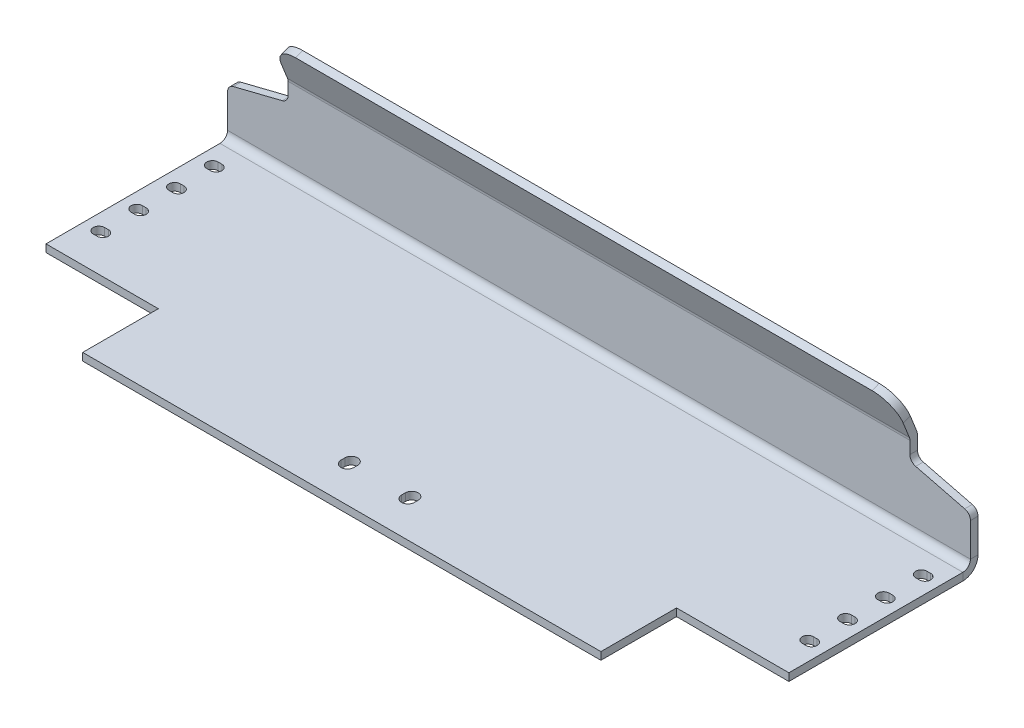
from build123d import *

# Parameters (mm, degrees)
SM_BASE_FLANGE_1_DEPTH = 491
CUT_EXTRUDE_1_REACH    = 576.223
CUT_EXTRUDE_2_DEPTH    = 575.223290751
PATTERN_LINEAR_1_COUNT = 4
PATTERN_LINEAR_1_PITCH = 50
FILLET_1_R             = 30
SKETCH_4_W             = 685
SKETCH_4_H             = 100
EXTRUDE_1_DEPTH        = 10
CUT_EXTRUDE_3_DEPTH    = 10
FILLET_2_R             = 10


# Sheet-metal steps are written as plain solids
with BuildPart() as part:
    # Sketch 1 → 基体-法兰1 (new, symmetric)
    with BuildSketch(Plane(origin=(0, 0, 0), x_dir=(0, 0, -1), z_dir=(1, 0, 0))):
        with BuildLine():
            Line((0, 0), (230, 0))
            ThreePointArc((230, 0), (237.071067812, 2.928932188), (240, 10))
            Line((240, 10), (240, 106.074175964))
            ThreePointArc((240, 106.074175964), (239.819563867, 107.965251176), (239.284766909, 109.788082728))
            Line((239.284766909, 109.788082728), (220, 158))
            Line((220, 158), (229.284766909, 161.713906764))
            Line((229.284766909, 161.713906764), (248.569533818, 113.501989491))
            ThreePointArc((248.569533818, 113.501989491), (249.639127735, 109.856326387), (250, 106.074175964))
            Line((250, 106.074175964), (250, 10))
            ThreePointArc((250, 10), (244.142135624, -4.142135624), (230, -10))
            Line((230, -10), (0, -10))
            Line((0, -10), (0, 0))
        make_face()
    extrude(amount=SM_BASE_FLANGE_1_DEPTH, both=True)

    # Sketch 2 → 切除-拉伸1 (cut, up to next)
    with BuildSketch(Plane(origin=(0, 0, -250), x_dir=(-1, 0, 0), z_dir=(0, 0, -1)), mode=Mode.PRIVATE) as cut_extrude_1_sk1:
        Polygon((-411, 161.713906764), (-411, 82), (-491, 62), (-491, 161.713906764), align=None)
    cut_extrude_1_tool1 = extrude(cut_extrude_1_sk1.sketch, amount=-CUT_EXTRUDE_1_REACH, mode=Mode.PRIVATE) & part.part
    # Sketch 2 → 切除-拉伸1 (cut, up to next)
    with BuildSketch(Plane(origin=(0, 0, -250), x_dir=(-1, 0, 0), z_dir=(0, 0, -1)), mode=Mode.PRIVATE) as cut_extrude_1_sk2:
        Polygon((491, 161.713906764), (411, 161.713906764), (411, 82), (491, 62), align=None)
    cut_extrude_1_tool2 = extrude(cut_extrude_1_sk2.sketch, amount=-CUT_EXTRUDE_1_REACH, mode=Mode.PRIVATE) & part.part
    add(cut_extrude_1_tool1.solids().sort_by_distance((452.486206, 116.671178, -250))[0], mode=Mode.SUBTRACT)
    add(cut_extrude_1_tool2.solids().sort_by_distance((-452.486206, 116.671178, -250))[0], mode=Mode.SUBTRACT)

    # 草图3 → 切除-拉伸2 (cut, through all)
    with BuildSketch(Plane(origin=(0, 0, 0), x_dir=(1, 0, 0), z_dir=(0, 1, 0))):
        with BuildLine():
            Line((466, 57.5), (471, 57.5))
            ThreePointArc((471, 57.5), (478.5, 50), (471, 42.5))
            Line((471, 42.5), (466, 42.5))
            ThreePointArc((466, 42.5), (458.5, 50), (466, 57.5))
        make_face()
        with BuildLine():
            Line((-466, 42.5), (-471, 42.5))
            ThreePointArc((-471, 42.5), (-478.5, 50), (-471, 57.5))
            Line((-471, 57.5), (-466, 57.5))
            ThreePointArc((-466, 57.5), (-458.5, 50), (-466, 42.5))
        make_face()
    cut_extrude_2 = extrude(amount=-CUT_EXTRUDE_2_DEPTH, mode=Mode.SUBTRACT)

    # 阵列(线性)1: 切除-拉伸2 ×4
    with Locations(*[(0, 0, -i * PATTERN_LINEAR_1_PITCH) for i in range(1, PATTERN_LINEAR_1_COUNT)]):
        add(cut_extrude_2, mode=Mode.SUBTRACT)

    # 圆角1
    fillet_1_edges = [part.edges().sort_by_distance(p)[0] for p in [
        (411, 159.856953382, -224.642383454),
        (-411, 159.856953382, -224.642383454),
    ]]
    fillet(fillet_1_edges, radius=FILLET_1_R)

    # 草图4 → 凸台-拉伸1 (add)
    with BuildSketch(Plane(origin=(0, 0, 0), x_dir=(1, 0, 0), z_dir=(0, 1, 0))):
        with Locations((0, -50)):
            Rectangle(SKETCH_4_W, SKETCH_4_H)
    extrude(amount=-EXTRUDE_1_DEPTH)

    # 草图5 → 切除-拉伸3 (cut)
    with BuildSketch(Plane(origin=(0, 0, 0), x_dir=(1, 0, 0), z_dir=(0, 1, 0))):
        with BuildLine():
            Line((-31.5, -47.5), (-31.5, -52.5))
            ThreePointArc((-31.5, -52.5), (-40, -61), (-48.5, -52.5))
            Line((-48.5, -52.5), (-48.5, -47.5))
            ThreePointArc((-48.5, -47.5), (-40, -39), (-31.5, -47.5))
        make_face()
        with BuildLine():
            Line((48.5, -47.5), (48.5, -52.5))
            ThreePointArc((48.5, -52.5), (40, -61), (31.5, -52.5))
            Line((31.5, -52.5), (31.5, -47.5))
            ThreePointArc((31.5, -47.5), (40, -39), (48.5, -47.5))
        make_face()
    extrude(amount=-CUT_EXTRUDE_3_DEPTH, mode=Mode.SUBTRACT)

    # 圆角2
    fillet_2_edges = [part.edges().sort_by_distance(p)[0] for p in [
        (491, 62, -245),
        (411, 82, -245),
        (-411, 82, -245),
        (-491, 62, -245),
    ]]
    fillet(fillet_2_edges, radius=FILLET_2_R)


solid = part.part
